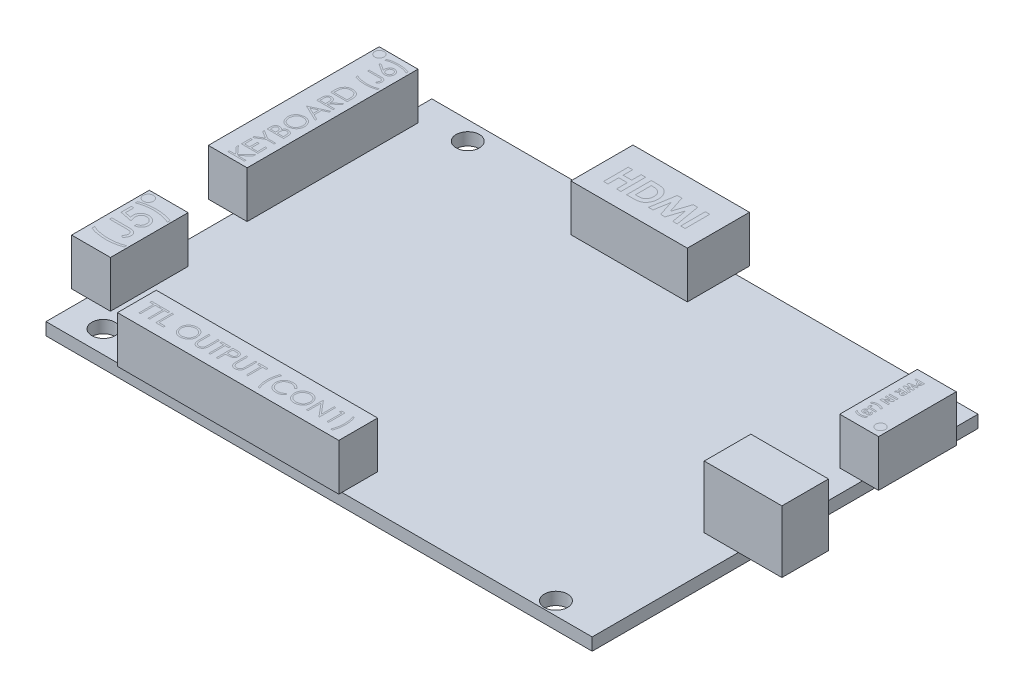
from build123d import *

# Parameters (mm, degrees)
SKETCH1_W           = 70.33
SKETCH1_H           = 49.68
SKETCH1_R           = 1.5
BOSS_EXTRUDE1_DEPTH = 1.6
SKETCH2_W           = 5
SKETCH2_H           = 22
BOSS_EXTRUDE2_DEPTH = 6
SKETCH4_W           = 5
SKETCH4_H           = 10
BOSS_EXTRUDE3_DEPTH = 6
SKETCH6_W           = 28.5
SKETCH6_H           = 5
BOSS_EXTRUDE4_DEPTH = 6
SKETCH8_W           = 10
SKETCH8_H           = 6
BOSS_EXTRUDE5_DEPTH = 8
SKETCH9_W           = 5
SKETCH9_H           = 10
BOSS_EXTRUDE6_DEPTH = 6
SKETCH11_W          = 15
SKETCH11_H          = 8
BOSS_EXTRUDE7_DEPTH = 6


with BuildPart() as part:
    # Sketch1 → Boss-Extrude1 (new body)
    with BuildSketch(Plane(origin=(0, 0, 0), x_dir=(1, 0, 0), z_dir=(0, 1, 0))):
        Rectangle(SKETCH1_W, SKETCH1_H)
        with Locations((31.055, 22.43)):
            Circle(SKETCH1_R, mode=Mode.SUBTRACT)
        with Locations((-28.125, 22.43)):
            Circle(SKETCH1_R, mode=Mode.SUBTRACT)
        with Locations((-30.645, -21.96)):
            Circle(SKETCH1_R, mode=Mode.SUBTRACT)
        with Locations((28.795, -23.14)):
            Circle(SKETCH1_R, mode=Mode.SUBTRACT)
    extrude(amount=BOSS_EXTRUDE1_DEPTH)

    # Sketch2 → Boss-Extrude2 (add)
    with BuildSketch(Plane(origin=(0, 1.6, 0), x_dir=(1, 0, 0), z_dir=(0, 1, 0))):
        with Locations((-35.865, 10.26)):
            Rectangle(SKETCH2_W, SKETCH2_H)
    extrude(amount=BOSS_EXTRUDE2_DEPTH)

    # Sketch4 → Boss-Extrude3 (add)
    with BuildSketch(Plane(origin=(0, 1.6, 0), x_dir=(1, 0, 0), z_dir=(0, 1, 0))):
        with Locations((-34.665, -14.54)):
            Rectangle(SKETCH4_W, SKETCH4_H)
    extrude(amount=BOSS_EXTRUDE3_DEPTH)

    # Sketch6 → Boss-Extrude4 (add)
    with BuildSketch(Plane(origin=(0, 1.6, 0), x_dir=(1, 0, 0), z_dir=(0, 1, 0))):
        with Locations((-11.315, -22.74)):
            Rectangle(SKETCH6_W, SKETCH6_H)
    extrude(amount=BOSS_EXTRUDE4_DEPTH)

    # Sketch8 → Boss-Extrude5 (add)
    with BuildSketch(Plane(origin=(0, 1.6, 0), x_dir=(1, 0, 0), z_dir=(0, 1, 0))):
        with Locations((35.765, -3.01)):
            Rectangle(SKETCH8_W, SKETCH8_H)
    extrude(amount=BOSS_EXTRUDE5_DEPTH)

    # Sketch9 → Boss-Extrude6 (add)
    with BuildSketch(Plane(origin=(0, 1.6, 0), x_dir=(1, 0, 0), z_dir=(0, 1, 0))):
        with Locations((34.765, 14.94)):
            Rectangle(SKETCH9_W, SKETCH9_H)
    extrude(amount=BOSS_EXTRUDE6_DEPTH)

    # Sketch11 → Boss-Extrude7 (add)
    with BuildSketch(Plane(origin=(0, 1.6, 0), x_dir=(1, 0, 0), z_dir=(0, 1, 0))):
        with Locations((-3.565, 22.64)):
            Rectangle(SKETCH11_W, SKETCH11_H)
    extrude(amount=BOSS_EXTRUDE7_DEPTH)


solid = part.part
